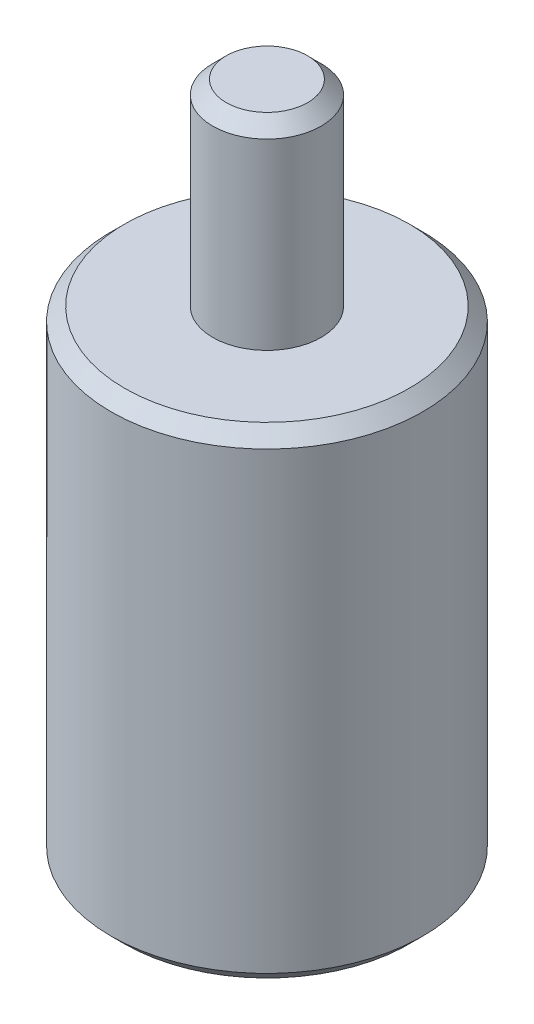
from build123d import *

# Parameters (mm, degrees)
SKETCH1_R           = 1.15
BOSS_EXTRUDE1_DEPTH = 5
SKETCH2_OUTSIDE_W   = 5.492
SKETCH2_OUTSIDE_H   = 5.492
SKETCH2_OUTSIDE_R   = 0.4
CUT_EXTRUDE1_DEPTH  = 1.45
CHAMFER1_SIZE       = 0.1
CHAMFER2_SIZE       = 0.1


with BuildPart() as part:
    # Sketch1 → Boss-Extrude1 (new body)
    with BuildSketch(Plane(origin=(0, 0, 0), x_dir=(1, 0, 0), z_dir=(0, 1, 0))):
        Circle(SKETCH1_R)
    extrude(amount=BOSS_EXTRUDE1_DEPTH)

    # Sketch2 outside → Cut-Extrude1 (cut)
    with BuildSketch(Plane(origin=(0, 5, 0), x_dir=(1, 0, 0), z_dir=(0, 1, 0))):
        Rectangle(SKETCH2_OUTSIDE_W, SKETCH2_OUTSIDE_H)
        Circle(SKETCH2_OUTSIDE_R, mode=Mode.SUBTRACT)
    extrude(amount=-CUT_EXTRUDE1_DEPTH, mode=Mode.SUBTRACT)

    # Chamfer1
    chamfer1_edges = [part.edges().sort_by_distance(p)[0] for p in [
        (-1.15, 3.55, 0),
        (-1.15, 0, 0),
    ]]
    chamfer(chamfer1_edges, length=CHAMFER1_SIZE)

    # Chamfer2
    chamfer2_edges = [part.edges().sort_by_distance(p)[0] for p in [
        (-0.4, 5, 0),
    ]]
    chamfer(chamfer2_edges, length=CHAMFER2_SIZE)

    # Sketch3 → Cut-Revolve1 (revolve, cut)
    with BuildSketch(Plane.XY):
        Polygon((0, 0), (0, 0.8), (0.8, 0), align=None)
    revolve(axis=Axis((0, 5, 0), (0, -1, 0)), mode=Mode.SUBTRACT)


solid = part.part
